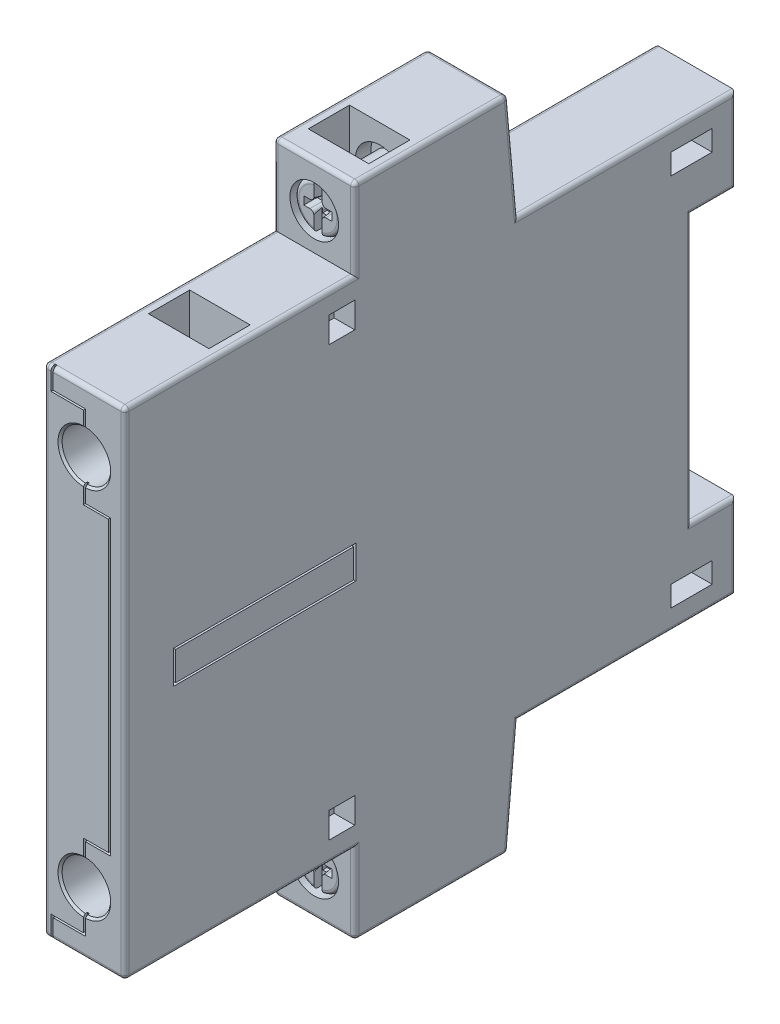
from build123d import *

# Parameters (mm, degrees)
BOSS_EXTRUDE1_DEPTH               = 5
BOSS_EXTRUDE1_DEPTH_BACK          = 5
FILLET5_R                         = 0.508
SKETCH5_R                         = 2.99974
CUT_EXTRUDE1_DEPTH                = 10
SKETCH6_R                         = 2.99974
CUT_EXTRUDE2_DEPTH                = 10
SKETCH7_W                         = 7.46
SKETCH7_H                         = 5.08
CUT_EXTRUDE3_DEPTH                = 12.7
SKETCH8_W                         = 7.46
SKETCH8_H                         = 5.08
CUT_EXTRUDE4_DEPTH                = 12.7
SKETCH9_R                         = 2.87274
BOSS_EXTRUDE2_DEPTH               = 3.81
BOSS_EXTRUDE3_DEPTH               = 1.27
BOSS_EXTRUDE3_DEPTH_BACK          = 2.54
SKETCH10_R                        = 2.87274
FILLET1_R                         = 0.508
FILLET2_R                         = 0.508
SKETCH11_W                        = 1
SKETCH11_H                        = 5.74548
CUT_EXTRUDE_THIN1_DEPTH           = 1
SKETCH12_W                        = 3.5
SKETCH12_H                        = 1
CUT_EXTRUDE_THIN2_DEPTH           = 1.500000048
CUT_EXTRUDE_THIN2_DRAFT           = -5
SKETCH12_W_2                      = 1
SKETCH12_H_2                      = 2.5
CUT_EXTRUDE_THIN2_PROFILE_2_DEPTH = 1.500000048
CUT_EXTRUDE_THIN2_PROFILE_2_DRAFT = -5
FILLET3_R                         = 0.508
SKETCH13_W                        = 1
SKETCH13_H                        = 5.74548
CUT_EXTRUDE_THIN3_DEPTH           = 1
SKETCH14_W                        = 3.5
SKETCH14_H                        = 1
CUT_EXTRUDE_THIN4_DEPTH           = 1.4986
CUT_EXTRUDE_THIN4_DRAFT           = -5
SKETCH14_W_2                      = 1
SKETCH14_H_2                      = 2.5
CUT_EXTRUDE_THIN4_PROFILE_2_DEPTH = 1.4986
CUT_EXTRUDE_THIN4_PROFILE_2_DRAFT = -5
FILLET4_R                         = 0.508
SKETCH15_R                        = 1.85674
BOSS_EXTRUDE4_DEPTH               = 5
SKETCH16_R                        = 1.85674
BOSS_EXTRUDE5_DEPTH               = 5
SKETCH17_W                        = 3.175
SKETCH17_H                        = 3.175
SKETCH17_W_2                      = 5.08
SKETCH17_H_2                      = 2.54
CUT_EXTRUDE5_DEPTH                = 2.54
SKETCH20_W                        = 22.479
SKETCH20_H                        = 4.064
SKETCH20_W_2                      = 21.971
SKETCH20_H_2                      = 3.556
CUT_EXTRUDE_THIN5_DEPTH           = 2.54
CHAMFER1_SIZE                     = 0.254
CUT_EXTRUDE_THIN6_DEPTH           = 86.763627021
CUT_EXTRUDE_THIN6_DEPTH_BACK      = 0.508


with BuildPart() as part:
    # Sketch3 → Boss-Extrude1 (new, two sides: drawn at the far end of the back side and taken through both)
    with BuildSketch(Plane(origin=(0, 0, 0), x_dir=(0, 0, -1), z_dir=(1, 0, 0)).offset(-BOSS_EXTRUDE1_DEPTH_BACK)):
        Polygon((-37.71646, -30.59938), (-37.71646, 30.59938), (-9.3472, 30.59938), (-9.3472, 40.5003), (9.6012, 40.5003), (10.841213709, 26.90114), (37.71646, 26.90114), (37.71646, 16.49984), (32.21736, 16.49984), (32.21736, -16.49984), (37.71646, -16.49984), (37.71646, -26.90114), (10.841213709, -26.90114), (9.6012, -40.5003), (-9.3472, -40.5003), (-9.3472, -30.59938), align=None)
    extrude(amount=BOSS_EXTRUDE1_DEPTH + BOSS_EXTRUDE1_DEPTH_BACK)

    # Fillet5
    fillet5_edges = [part.edges().sort_by_distance(p)[0] for p in [
        (5, -40.5003, -0.127),
        (5, -33.70072, -10.221206855),
        (5, -26.90114, -24.278836855),
        (5, -21.70049, -37.71646),
        (5, -16.49984, -34.96691),
        (5, 0, -32.21736),
        (0, -30.59938, 37.71646),
        (0, 30.59938, 37.71646),
        (0, 40.5003, 9.3472),
        (0, 40.5003, -9.6012),
        (0, -40.5003, -9.6012),
        (0, -40.5003, 9.3472),
        (5, 16.49984, -34.96691),
        (5, 21.70049, -37.71646),
        (5, 26.90114, -24.278836855),
        (5, 33.70072, -10.221206855),
        (-5, -30.59938, 23.53183),
        (-5, 0, 37.71646),
        (-5, 30.59938, 23.53183),
        (-5, 35.54984, 9.3472),
        (-5, 40.5003, -0.127),
        (-5, 33.70072, -10.221206855),
        (-5, 26.90114, -24.278836855),
        (5, -30.59938, 23.53183),
        (5, 40.5003, -0.127),
        (-5, 21.70049, -37.71646),
        (-5, 16.49984, -34.96691),
        (-5, 0, -32.21736),
        (-5, -16.49984, -34.96691),
        (-5, -21.70049, -37.71646),
        (-5, -26.90114, -24.278836855),
        (-5, -33.70072, -10.221206855),
        (-5, -40.5003, -0.127),
        (5, 35.54984, 9.3472),
        (-5, -35.54984, 9.3472),
        (5, 30.59938, 23.53183),
        (5, 0, 37.71646),
        (5, -35.54984, 9.3472),
    ]]
    fillet(fillet5_edges, radius=FILLET5_R)

    # Sketch5 → Cut-Extrude1 (cut)
    with BuildSketch(Plane.XY.offset(37.71646)):
        with Locations((0, -22.9997)):
            Circle(SKETCH5_R)
        with Locations((0, 22.9997)):
            Circle(SKETCH5_R)
    extrude(amount=-CUT_EXTRUDE1_DEPTH, mode=Mode.SUBTRACT)

    # Sketch6 → Cut-Extrude2 (cut)
    with BuildSketch(Plane.XY.offset(9.3472)):
        with Locations((0, -35.1155)):
            Circle(SKETCH6_R)
        with Locations((0, 35.1155)):
            Circle(SKETCH6_R)
    extrude(amount=-CUT_EXTRUDE2_DEPTH, mode=Mode.SUBTRACT)

    # Sketch7 → Cut-Extrude3 (cut)
    with BuildSketch(Plane(origin=(0, 30.59938, 0), x_dir=(1, 0, 0), z_dir=(0, 1, 0))):
        with Locations((0, -23.53183)):
            Rectangle(SKETCH7_W, SKETCH7_H)
    cut_extrude3 = extrude(amount=-CUT_EXTRUDE3_DEPTH, mode=Mode.SUBTRACT)

    # Sketch8 → Cut-Extrude4 (cut)
    with BuildSketch(Plane(origin=(0, 40.5003, 0), x_dir=(1, 0, 0), z_dir=(0, 1, 0))):
        with Locations((0, -3.81)):
            Rectangle(SKETCH8_W, SKETCH8_H)
    cut_extrude4 = extrude(amount=-CUT_EXTRUDE4_DEPTH, mode=Mode.SUBTRACT)

    # Mirror1: Cut-Extrude3, Cut-Extrude4 across plane
    add(cut_extrude3.mirror(Plane.ZX), mode=Mode.SUBTRACT)
    add(cut_extrude4.mirror(Plane.ZX), mode=Mode.SUBTRACT)

    # Sketch17 → Cut-Extrude5 (cut)
    with BuildSketch(Plane.ZY.offset(5)):
        with Locations((10.9347, 26.47188)):
            Rectangle(SKETCH17_W, SKETCH17_H)
        with Locations((-32.21736, 23.09114)):
            Rectangle(SKETCH17_W_2, SKETCH17_H_2)
        with Locations((-32.21736, -23.09114)):
            Rectangle(SKETCH17_W_2, SKETCH17_H_2)
        with Locations((10.9347, -26.47188)):
            Rectangle(SKETCH17_W, SKETCH17_H)
    cut_extrude5 = extrude(amount=-CUT_EXTRUDE5_DEPTH, mode=Mode.SUBTRACT)

    # Sketch20 → Cut-Extrude-Thin5 (cut)
    with BuildSketch(Plane.ZY.offset(5)):
        with Locations((20.4597, 0)):
            Rectangle(SKETCH20_W, SKETCH20_H)
        with Locations((20.4597, 0)):
            Rectangle(SKETCH20_W_2, SKETCH20_H_2, mode=Mode.SUBTRACT)
    cut_extrude_thin5 = extrude(amount=-CUT_EXTRUDE_THIN5_DEPTH, mode=Mode.SUBTRACT)

    # Mirror2: Cut-Extrude5, Cut-Extrude-Thin5 across plane
    add(cut_extrude5.mirror(Plane(origin=(0, 0, 0), x_dir=(0, 0, 1), z_dir=(1, 0, 0))), mode=Mode.SUBTRACT)
    add(cut_extrude_thin5.mirror(Plane(origin=(0, 0, 0), x_dir=(0, 0, 1), z_dir=(1, 0, 0))), mode=Mode.SUBTRACT)

    # Chamfer1
    chamfer1_edges = [part.edges().sort_by_distance(p)[0] for p in [
        (-2.99974, -22.9997, 37.71646),
        (-2.99974, 22.9997, 37.71646),
    ]]
    chamfer(chamfer1_edges, length=CHAMFER1_SIZE)

    # Sketch21 → Cut-Extrude-Thin6 (cut, two sides: drawn at the far end of the back side and taken through both)
    with BuildSketch(Plane.XY.offset(37.71646).offset(-CUT_EXTRUDE_THIN6_DEPTH_BACK)):
        Polygon((-3.857, -30.59938), (-3.857, -28.18638), (0.127, -28.18638), (0.127, -18.06702), (3.222, -18.06702), (3.222, 18.06702), (0.127, 18.06702), (0.127, 28.18638), (-3.857, 28.18638), (-3.857, 30.59938), (-4.111, 30.59938), (-4.111, 27.93238), (-0.127, 27.93238), (-0.127, 17.81302), (2.968, 17.81302), (2.968, -17.81302), (-0.127, -17.81302), (-0.127, -27.93238), (-4.111, -27.93238), (-4.111, -30.59938), align=None)
    extrude(amount=CUT_EXTRUDE_THIN6_DEPTH + CUT_EXTRUDE_THIN6_DEPTH_BACK, mode=Mode.SUBTRACT)


with BuildPart() as body_2:
    # Sketch9 → Boss-Extrude2 (new body)
    with BuildSketch(Plane.XY.offset(27.71646)):
        with Locations(Location((0, 22.9997, 0), (0, 0, 180))):
            Circle(SKETCH9_R)
    extrude(amount=BOSS_EXTRUDE2_DEPTH)

    # Fillet2
    fillet2_edges = [body_2.edges().sort_by_distance(p)[0] for p in [
        (2.87274, 22.9997, 31.52646),
    ]]
    fillet(fillet2_edges, radius=FILLET2_R)

    # Sketch11 → Cut-Extrude-Thin1 (cut)
    with BuildSketch(Plane.XY.offset(31.52646)):
        with Locations((0, 22.9997)):
            Rectangle(SKETCH11_W, SKETCH11_H)
    extrude(amount=-CUT_EXTRUDE_THIN1_DEPTH, mode=Mode.SUBTRACT)


with BuildPart() as body_3:
    # Sketch10 → Boss-Extrude3 (new, two sides: drawn at the far end of the back side and taken through both)
    with BuildSketch(Plane(origin=(0, 0, 6.35), x_dir=(-1, 0, 0), z_dir=(0, 0, -1)).offset(-BOSS_EXTRUDE3_DEPTH_BACK)):
        with Locations(Location((0, 35.1155, 0), (0, 0, 90))):
            Circle(SKETCH10_R)
    extrude(amount=BOSS_EXTRUDE3_DEPTH + BOSS_EXTRUDE3_DEPTH_BACK)

    # Fillet1
    fillet1_edges = [body_3.edges().sort_by_distance(p)[0] for p in [
        (0, 32.24276, 8.89),
    ]]
    fillet(fillet1_edges, radius=FILLET1_R)

    # Sketch13 → Cut-Extrude-Thin3 (cut)
    with BuildSketch(Plane.XY.offset(8.89)):
        with Locations((0, 35.1155)):
            Rectangle(SKETCH13_W, SKETCH13_H)
    extrude(amount=-CUT_EXTRUDE_THIN3_DEPTH, mode=Mode.SUBTRACT)


with BuildPart() as cut_extrude_thin2_tool:
    # Sketch12 → Cut-Extrude-Thin2 (with draft: the straight prism first)
    with BuildSketch(Plane.XY.offset(31.52646)):
        with Locations((0, 22.9997)):
            Rectangle(SKETCH12_W, SKETCH12_H)
    extrude(amount=-CUT_EXTRUDE_THIN2_DEPTH)
    # Cut-Extrude-Thin2: the draft: its side faces are tilted about the plane it starts from
    cut_extrude_thin2_sides = [cut_extrude_thin2_tool.faces().sort_by_distance(p)[0] for p in [
        (0, 22.4997, 30.776459976),
        (1.75, 22.9997, 30.776459976),
        (0, 23.4997, 30.776459976),
        (-1.75, 22.9997, 30.776459976),
    ]]
    draft(cut_extrude_thin2_sides, Plane.XY.offset(31.52646), CUT_EXTRUDE_THIN2_DRAFT)


with BuildPart() as body_2_1:
    add(body_2.part)

    # Cut-Extrude-Thin2: cut by cut_extrude_thin2_tool
    add(cut_extrude_thin2_tool.part, mode=Mode.SUBTRACT)


with BuildPart() as cut_extrude_thin2_profile_2_tool:
    # Sketch12 → Cut-Extrude-Thin2 profile 2 (with draft: the straight prism first)
    with BuildSketch(Plane.XY.offset(31.52646)):
        with Locations((0, 22.9997)):
            Rectangle(SKETCH12_W_2, SKETCH12_H_2)
    extrude(amount=-CUT_EXTRUDE_THIN2_PROFILE_2_DEPTH)
    # Cut-Extrude-Thin2 profile 2: the draft: its side faces are tilted about the plane it starts from
    cut_extrude_thin2_profile_2_sides = [cut_extrude_thin2_profile_2_tool.faces().sort_by_distance(p)[0] for p in [
        (0.5, 22.9997, 30.776459976),
        (0, 24.2497, 30.776459976),
        (-0.5, 22.9997, 30.776459976),
        (0, 21.7497, 30.776459976),
    ]]
    draft(cut_extrude_thin2_profile_2_sides, Plane.XY.offset(31.52646), CUT_EXTRUDE_THIN2_PROFILE_2_DRAFT)


with BuildPart() as body_2_2:
    add(body_2_1.part)

    # Cut-Extrude-Thin2 profile 2: cut by cut_extrude_thin2_profile_2_tool
    add(cut_extrude_thin2_profile_2_tool.part, mode=Mode.SUBTRACT)

    # Fillet3
    # the kernel refuses this fillet: 0.508 mm, written as the material it takes off along each edge
    with BuildSketch(Plane(origin=(-0.521946645, 22.477753355, 31.777311302), x_dir=(0.007567436278487836, -0.9962234400966146, -0.08649619246092907), z_dir=(0.08682659386424793, 0.08682659386424793, -0.9924325091389671))) as fillet3_piece_1_section:
        with BuildLine():
            CenterArc((FILLET3_R * 0.992432509139, FILLET3_R), FILLET3_R, 180.435230002, 89.564769998)
            Line((-FILLET3_R * 0.00753863989878, FILLET3_R * 0.992403876506), (0, 0))
            Line((0, 0), (FILLET3_R * 0.992432509139, 0))
        make_face()
    fillet3_piece_1 = extrude(amount=3.024591219, mode=Mode.PRIVATE)
    fillet3_piece_1 = split(fillet3_piece_1, bisect_by=Plane(origin=(-0.55872514, 22.44097486, 30.026459952), z_dir=(0, 0, 1)), keep=Keep.TOP, mode=Mode.PRIVATE)
    add(fillet3_piece_1, mode=Mode.SUBTRACT)
    with BuildSketch(Plane(origin=(0.259331692, 22.740368308, 28.77560865), x_dir=(0.9962234400966146, 0.007567436278489717, -0.0864961924609289), z_dir=(0.08682659386424793, -0.08682659386424793, 0.9924325091389671))) as fillet3_piece_2_section:
        with BuildLine():
            CenterArc((FILLET3_R * 0.992432509139, -FILLET3_R), FILLET3_R, 90, 89.564769998)
            Line((-FILLET3_R * 0.00753863989878, -FILLET3_R * 0.992403876506), (0, 0))
            Line((0, 0), (FILLET3_R * 0.992432509139, 0))
        make_face()
    fillet3_piece_2 = extrude(amount=3.024591219, mode=Mode.PRIVATE)
    fillet3_piece_2 = split(fillet3_piece_2, bisect_by=Plane(origin=(0.55872514, 22.44097486, 30.026459952), z_dir=(0, 0, 1)), keep=Keep.TOP, mode=Mode.PRIVATE)
    add(fillet3_piece_2, mode=Mode.SUBTRACT)
    with BuildSketch(Plane(origin=(0.521946645, 23.521646645, 31.777311302), x_dir=(-0.0075674362784882735, 0.9962234400966146, -0.08649619246092903), z_dir=(-0.08682659386424793, -0.08682659386424793, -0.9924325091389671))) as fillet3_piece_3_section:
        with BuildLine():
            CenterArc((FILLET3_R * 0.992432509139, FILLET3_R), FILLET3_R, 180.435230002, 89.564769998)
            Line((-FILLET3_R * 0.00753863989878, FILLET3_R * 0.992403876506), (0, 0))
            Line((0, 0), (FILLET3_R * 0.992432509139, 0))
        make_face()
    fillet3_piece_3 = extrude(amount=3.024591219, mode=Mode.PRIVATE)
    fillet3_piece_3 = split(fillet3_piece_3, bisect_by=Plane(origin=(0.55872514, 23.55842514, 30.026459952), z_dir=(0, 0, 1)), keep=Keep.TOP, mode=Mode.PRIVATE)
    add(fillet3_piece_3, mode=Mode.SUBTRACT)
    with BuildSketch(Plane(origin=(-0.259331692, 23.259031692, 28.77560865), x_dir=(-0.9962234400966146, -0.007567436278489717, -0.0864961924609289), z_dir=(-0.08682659386424793, 0.08682659386424793, 0.9924325091389671))) as fillet3_piece_4_section:
        with BuildLine():
            CenterArc((FILLET3_R * 0.992432509139, -FILLET3_R), FILLET3_R, 90, 89.564769998)
            Line((-FILLET3_R * 0.00753863989878, -FILLET3_R * 0.992403876506), (0, 0))
            Line((0, 0), (FILLET3_R * 0.992432509139, 0))
        make_face()
    fillet3_piece_4 = extrude(amount=3.024591219, mode=Mode.PRIVATE)
    fillet3_piece_4 = split(fillet3_piece_4, bisect_by=Plane(origin=(-0.55872514, 23.55842514, 30.026459952), z_dir=(0, 0, 1)), keep=Keep.TOP, mode=Mode.PRIVATE)
    add(fillet3_piece_4, mode=Mode.SUBTRACT)

    # Sketch16 → Boss-Extrude5 (add)
    with BuildSketch(Plane(origin=(0, 0, 27.71646), x_dir=(-1, 0, 0), z_dir=(0, 0, -1))):
        with Locations((0, 22.9997)):
            Circle(SKETCH16_R)
    extrude(amount=BOSS_EXTRUDE5_DEPTH)


with BuildPart() as cut_extrude_thin4_tool:
    # Sketch14 → Cut-Extrude-Thin4 (with draft: the straight prism first)
    with BuildSketch(Plane.XY.offset(8.89)):
        with Locations((0, 35.1155)):
            Rectangle(SKETCH14_W, SKETCH14_H)
    extrude(amount=-CUT_EXTRUDE_THIN4_DEPTH)
    # Cut-Extrude-Thin4: the draft: its side faces are tilted about the plane it starts from
    cut_extrude_thin4_sides = [cut_extrude_thin4_tool.faces().sort_by_distance(p)[0] for p in [
        (0, 34.6155, 8.1407),
        (1.75, 35.1155, 8.1407),
        (0, 35.6155, 8.1407),
        (-1.75, 35.1155, 8.1407),
    ]]
    draft(cut_extrude_thin4_sides, Plane.XY.offset(8.89), CUT_EXTRUDE_THIN4_DRAFT)


with BuildPart() as body_3_1:
    add(body_3.part)

    # Cut-Extrude-Thin4: cut by cut_extrude_thin4_tool
    add(cut_extrude_thin4_tool.part, mode=Mode.SUBTRACT)


with BuildPart() as cut_extrude_thin4_profile_2_tool:
    # Sketch14 → Cut-Extrude-Thin4 profile 2 (with draft: the straight prism first)
    with BuildSketch(Plane.XY.offset(8.89)):
        with Locations((0, 35.1155)):
            Rectangle(SKETCH14_W_2, SKETCH14_H_2)
    extrude(amount=-CUT_EXTRUDE_THIN4_PROFILE_2_DEPTH)
    # Cut-Extrude-Thin4 profile 2: the draft: its side faces are tilted about the plane it starts from
    cut_extrude_thin4_profile_2_sides = [cut_extrude_thin4_profile_2_tool.faces().sort_by_distance(p)[0] for p in [
        (0.5, 35.1155, 8.1407),
        (0, 36.3655, 8.1407),
        (-0.5, 35.1155, 8.1407),
        (0, 33.8655, 8.1407),
    ]]
    draft(cut_extrude_thin4_profile_2_sides, Plane.XY.offset(8.89), CUT_EXTRUDE_THIN4_PROFILE_2_DRAFT)


with BuildPart() as body_3_2:
    add(body_3_1.part)

    # Cut-Extrude-Thin4 profile 2: cut by cut_extrude_thin4_profile_2_tool
    add(cut_extrude_thin4_profile_2_tool.part, mode=Mode.SUBTRACT)

    # Fillet4
    fillet4_edges = [body_3_2.edges().sort_by_distance(p)[0] for p in [
        (-0.390700413, 34.724799587, 7.6407),
        (0.390700413, 35.506200413, 7.6407),
        (0.390700413, 34.724799587, 7.6407),
        (-0.390700413, 35.506200413, 7.6407),
    ]]
    fillet(fillet4_edges, radius=FILLET4_R)

    # Sketch15 → Boss-Extrude4 (add)
    with BuildSketch(Plane(origin=(0, 0, 5.08), x_dir=(-1, 0, 0), z_dir=(0, 0, -1))):
        with Locations(Location((0, 35.1155, 0), (0, 0, 90))):
            Circle(SKETCH15_R)
    extrude(amount=BOSS_EXTRUDE4_DEPTH)


with BuildPart() as body_4:
    # Mirror3: mirrored copy
    add(body_3_2.part.mirror(Plane.ZX))


with BuildPart() as body_5:
    # Mirror3 2: mirrored copy
    add(body_2_2.part.mirror(Plane.ZX))


solid = Compound([part.part, body_2_2.part, body_3_2.part, body_4.part, body_5.part])
